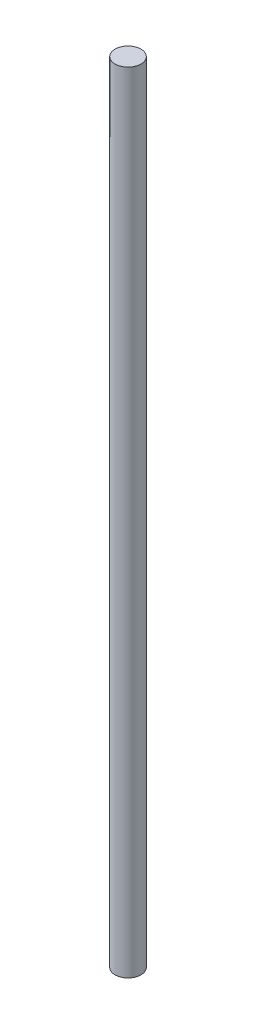
from build123d import *

# Parameters (mm, degrees)
SKETCH1_R           = 5
BOSS_EXTRUDE1_DEPTH = 304.8


with BuildPart() as part:
    # Sketch1 → Boss-Extrude1 (new body)
    with BuildSketch(Plane(origin=(0, 0, 0), x_dir=(1, 0, 0), z_dir=(0, 1, 0))):
        Circle(SKETCH1_R)
    extrude(amount=BOSS_EXTRUDE1_DEPTH)


solid = part.part
